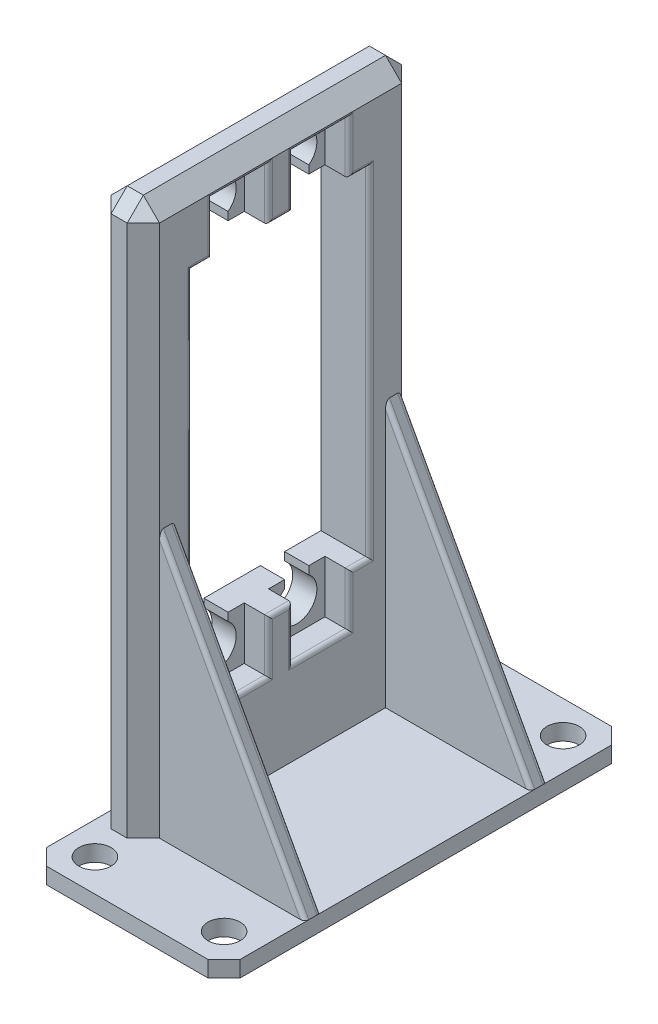
from build123d import *

# Parameters (mm, degrees)
SKETCH1_W           = 34
SKETCH1_H           = 70
SKETCH1_W_2         = 22
SKETCH1_H_2         = 42
BOSS_EXTRUDE1_DEPTH = 3
CUT_EXTRUDE1_DEPTH  = 44.874821937
CHAMFER1_SIZE       = 2
SKETCH3_W           = 7
SKETCH3_H           = 7
CUT_EXTRUDE2_DEPTH  = 3
SKETCH4_W           = 24
SKETCH4_H           = 50
SKETCH4_R           = 2
BOSS_EXTRUDE2_DEPTH = 2
CHAMFER2_SIZE       = 2
BOSS_EXTRUDE3_START = -10
BOSS_EXTRUDE3_DEPTH = 2
BOSS_EXTRUDE4_START = -40
BOSS_EXTRUDE4_DEPTH = 2
FILLET1_R           = 0.5


with BuildPart() as part:
    # Sketch1 → Boss-Extrude1 (new, symmetric)
    with BuildSketch(Plane(origin=(0, 0, 0), x_dir=(0, 0, -1), z_dir=(1, 0, 0))):
        with Locations((0, -5)):
            Rectangle(SKETCH1_W, SKETCH1_H)
        Rectangle(SKETCH1_W_2, SKETCH1_H_2, mode=Mode.SUBTRACT)
    extrude(amount=BOSS_EXTRUDE1_DEPTH, both=True)

    # Sketch2 → Cut-Extrude1 (cut, through all)
    with BuildSketch(Plane.ZY.offset(3)):
        with BuildLine():
            Line((-6.5, -21), (-6.5, -22))
            ThreePointArc((-6.5, -22), (-5, -26.5), (-3.5, -22))
            Line((-3.5, -22), (-3.5, -21))
            Line((-3.5, -21), (-6.5, -21))
        make_face()
        with BuildLine():
            Line((3.5, -21), (3.5, -22))
            ThreePointArc((3.5, -22), (5, -26.5), (6.5, -22))
            Line((6.5, -22), (6.5, -21))
            Line((6.5, -21), (3.5, -21))
        make_face()
        with BuildLine():
            Line((6.5, 21), (6.5, 22))
            ThreePointArc((6.5, 22), (5, 26.5), (3.5, 22))
            Line((3.5, 22), (3.5, 21))
            Line((3.5, 21), (6.5, 21))
        make_face()
        with BuildLine():
            Line((-3.5, 21), (-3.5, 22))
            ThreePointArc((-3.5, 22), (-5, 26.5), (-6.5, 22))
            Line((-6.5, 22), (-6.5, 21))
            Line((-6.5, 21), (-3.5, 21))
        make_face()
    extrude(amount=-CUT_EXTRUDE1_DEPTH, mode=Mode.SUBTRACT)

    # Chamfer1
    chamfer1_edges = [part.edges().sort_by_distance(p)[0] for p in [
        (3, -5, 17),
        (3, 30, 0),
        (-3, -5, 17),
        (-3, -5, -17),
        (-3, 30, 0),
        (3, -5, -17),
        (0, 30, 17),
        (0, 30, -17),
    ]]
    chamfer(chamfer1_edges, length=CHAMFER1_SIZE)

    # Sketch3 → Cut-Extrude2 (cut)
    with BuildSketch(Plane(origin=(3, 0, 0), x_dir=(0, 0, -1), z_dir=(1, 0, 0))):
        with Locations((5, 24)):
            Rectangle(SKETCH3_W, SKETCH3_H)
        with Locations((5, -24)):
            Rectangle(SKETCH3_W, SKETCH3_H)
        with Locations((-5, -24)):
            Rectangle(SKETCH3_W, SKETCH3_H)
        with Locations((-5, 24)):
            Rectangle(SKETCH3_W, SKETCH3_H)
    extrude(amount=-CUT_EXTRUDE2_DEPTH, mode=Mode.SUBTRACT)

    # Sketch4 → Boss-Extrude2 (add)
    with BuildSketch(Plane.XZ.offset(40)):
        with Locations((9, 0)):
            Rectangle(SKETCH4_W, SKETCH4_H)
        with Locations(Location((1, -21, 0), (0, 0, 270))):
            Circle(SKETCH4_R, mode=Mode.SUBTRACT)
        with Locations(Location((17, -21, 0), (0, 0, 270))):
            Circle(SKETCH4_R, mode=Mode.SUBTRACT)
        with Locations(Location((17, 21, 0), (0, 0, 270))):
            Circle(SKETCH4_R, mode=Mode.SUBTRACT)
        with Locations(Location((1, 21, 0), (0, 0, 270))):
            Circle(SKETCH4_R, mode=Mode.SUBTRACT)
    extrude(amount=-BOSS_EXTRUDE2_DEPTH)

    # Chamfer2
    chamfer2_edges = [part.edges().sort_by_distance(p)[0] for p in [
        (-3, -39, -25),
        (-3, -39, 25),
        (21, -39, 25),
        (21, -39, -25),
    ]]
    chamfer(chamfer2_edges, length=CHAMFER2_SIZE)

    # Sketch5 → Boss-Extrude3 (add)
    with BuildSketch(Plane(origin=(0, 0, -25), x_dir=(-1, 0, 0), z_dir=(0, 0, -1)).offset(BOSS_EXTRUDE3_START)):
        Polygon((-3, -38), (-21, -38), (-3, -5), align=None)
    extrude(amount=-BOSS_EXTRUDE3_DEPTH)

    # Sketch5<2> → Boss-Extrude4 (add)
    with BuildSketch(Plane(origin=(0, 0, -25), x_dir=(-1, 0, 0), z_dir=(0, 0, -1)).offset(BOSS_EXTRUDE4_START)):
        Polygon((-3, -38), (-21, -38), (-3, -5), align=None)
    extrude(amount=BOSS_EXTRUDE4_DEPTH)

    # Fillet1
    fillet1_edges = [part.edges().sort_by_distance(p)[0] for p in [
        (3, 21, -9.75),
        (3, 24.25, -8.5),
        (3, 27.5, -5),
        (3, 24.25, -1.5),
        (3, -21, -9.75),
        (3, -24.25, -1.5),
        (3, -27.5, -5),
        (3, -24.25, -8.5),
        (3, 21, 9.75),
        (3, 0, 11),
        (3, -21, 9.75),
        (3, -21, 0),
        (3, 0, -11),
        (3, -24.25, 8.5),
        (3, -27.5, 5),
        (3, -24.25, 1.5),
        (3, 21, 0),
        (3, 24.25, 1.5),
        (3, 27.5, 5),
        (3, 24.25, 8.5),
        (12, -21.5, -13),
        (12, -21.5, -15),
        (12, -21.5, 13),
        (12, -21.5, 15),
    ]]
    fillet(fillet1_edges, radius=FILLET1_R - 0.0001)  # a hair under: the kernel refuses the full size


solid = part.part
